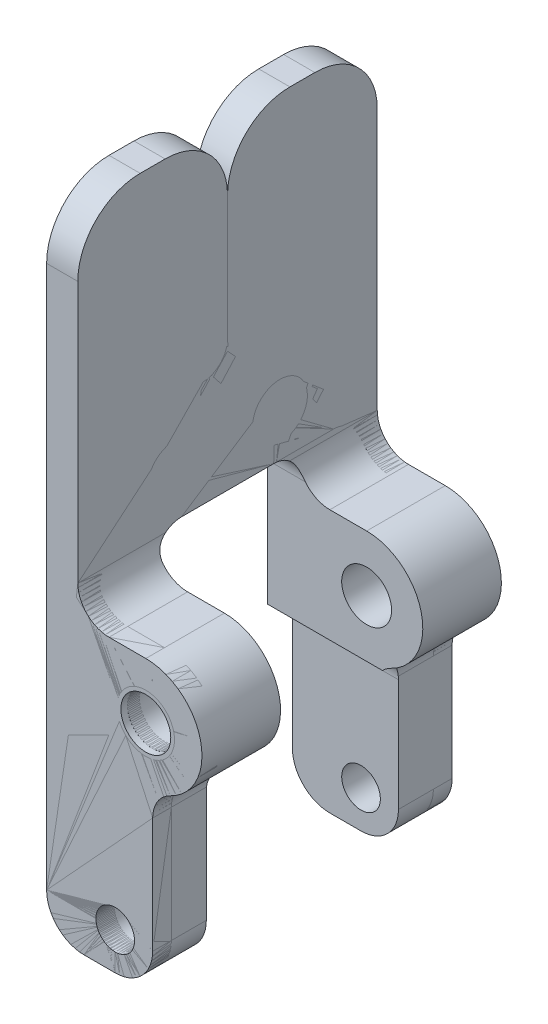
from build123d import *

# Parameters (mm, degrees)
CROQUIS1_R              = 2
CROQUIS1_R_2            = 1.55
SALIENTE_EXTRUIR1_DEPTH = 24
CORTAR_EXTRUIR1_DEPTH   = 20
REDONDEO1_R             = 8
REDONDEO2_R             = 2
REDONDEO5_R             = 2.5
CROQUIS3_R              = 2.2
CORTAR_EXTRUIR2_DEPTH   = 20
CROQUIS4_W              = 1.5
CROQUIS4_H              = 7.2
CORTAR_EXTRUIR3_DEPTH   = 20
SALIENTE_EXTRUIR2_REACH = 43.512
REDONDEO7_R             = 2
CROQUIS6_W              = 7.2
CROQUIS6_H              = 3
CORTAR_EXTRUIR4_DEPTH   = 1.5
REDONDEO8_R             = 3
REDONDEO9_R             = 5
CHAFL_N1_SIZE           = 0.3
CHAFL_N1_SIZE2          = 0.519615242


with BuildPart() as part:
    # Croquis1 → Saliente-Extruir1 (new body)
    with BuildSketch(Plane.XY):
        with BuildLine():
            Line((-5.5, 0), (-5.5, 31.5))
            Line((-5.5, 31.5), (-3, 31.5))
            Line((-3, 31.5), (-3, 20.05))
            Line((-3, 20.05), (2.45, 20.05))
            ThreePointArc((2.45, 20.05), (6.941557686, 15.825516889), (3, 11.08373758))
            Line((3, 11.08373758), (3, 0))
            ThreePointArc((3, 0), (2.121320344, -2.121320344), (0, -3))
            Line((0, -3), (-2.5, -3))
            ThreePointArc((-2.5, -3), (-4.621320344, -2.121320344), (-5.5, 0))
        make_face()
        with Locations((2.45, 15.55)):
            Circle(CROQUIS1_R, mode=Mode.SUBTRACT)
        Circle(CROQUIS1_R_2, mode=Mode.SUBTRACT)
    extrude(amount=SALIENTE_EXTRUIR1_DEPTH)

    # Croquis2 → Cortar-Extruir1 (cut)
    with BuildSketch(Plane.ZY.offset(5.5)):
        Polygon((1.5, -3), (19.7, -3), (19.7, 11), (17.7, 11), (17.7, 23), (1.5, 23), align=None)
    extrude(amount=-CORTAR_EXTRUIR1_DEPTH, mode=Mode.SUBTRACT)

    # Redondeo1
    redondeo1_edges = [part.edges().sort_by_distance(p)[0] for p in [
        (-4.25, 31.5, 0),
        (-4.25, 31.5, 24),
    ]]
    fillet(redondeo1_edges, radius=REDONDEO1_R)

    # Redondeo2
    redondeo2_edges = [part.edges().sort_by_distance(p)[0] for p in [
        (-1.25, 11, 19.7),
        (-4.25, 23, 17.7),
        (-4.25, 23, 1.5),
    ]]
    fillet(redondeo2_edges, radius=REDONDEO2_R - 0.0001)  # a hair under: the kernel refuses the full size

    # Redondeo5
    redondeo5_edges = [part.edges().sort_by_distance(p)[0] for p in [
        (3, 11.08373758, 0.75),
        (-3, 20.05, 20.85),
        (3, 11.08373758, 20.85),
        (-3, 20.05, 0.75),
    ]]
    fillet(redondeo5_edges, radius=REDONDEO5_R)

    # Croquis3 → Cortar-Extruir2 (cut)
    with BuildSketch(Plane.ZY.offset(5.5)):
        with Locations((7.8, 26.4)):
            Circle(CROQUIS3_R)
    extrude(amount=-CORTAR_EXTRUIR2_DEPTH, mode=Mode.SUBTRACT)

    # Croquis4 → Cortar-Extruir3 (cut)
    with BuildSketch(Plane.XZ.offset(-23)):
        with Locations((-4.75, 7.8)):
            Rectangle(CROQUIS4_W, CROQUIS4_H)
    extrude(amount=-CORTAR_EXTRUIR3_DEPTH, mode=Mode.SUBTRACT)

    # Saliente-Extruir2: up to this face of the body (flat: up to its plane)
    saliente_extruir2_end = Plane(part.part.faces().sort_by_distance((-3, 26.79790631, 12.475730365))[0])
    # Croquis5 → Saliente-Extruir2 (add, up to the picked face)
    with BuildSketch(Plane.ZY.offset(5.5), mode=Mode.PRIVATE) as saliente_extruir2_sk1:
        Polygon((0, 23.5), (0, 48.5), (12, 48.5), (12, 30), (4.2, 30), align=None)
    saliente_extruir2_tool1 = split(extrude(saliente_extruir2_sk1.sketch, amount=-SALIENTE_EXTRUIR2_REACH, mode=Mode.PRIVATE), bisect_by=saliente_extruir2_end, keep=Keep.BOTH, mode=Mode.PRIVATE)
    add(saliente_extruir2_tool1.solids().sort_by(Axis((-5.5, 38.588691, 5.733546), (1, 0, 0)))[0])

    # Redondeo7
    redondeo7_edges = [part.edges().sort_by_distance(p)[0] for p in [
        (-4.25, 31.5, 12),
    ]]
    fillet(redondeo7_edges, radius=REDONDEO7_R)

    # Croquis6 → Cortar-Extruir4 (cut)
    with BuildSketch(Plane.ZY.offset(5.5)):
        with Locations((7.8, 30)):
            Rectangle(CROQUIS6_W, CROQUIS6_H)
    extrude(amount=-CORTAR_EXTRUIR4_DEPTH, mode=Mode.SUBTRACT)

    # Redondeo8
    redondeo8_edges = [part.edges().sort_by_distance(p)[0] for p in [
        (-4.75, 31.5, 4.2),
        (-4.75, 31.5, 11.4),
    ]]
    fillet(redondeo8_edges, radius=REDONDEO8_R)

    # Redondeo9
    redondeo9_edges = [part.edges().sort_by_distance(p)[0] for p in [
        (-4.25, 48.5, 12),
        (-4.25, 48.5, 0),
    ]]
    fillet(redondeo9_edges, radius=REDONDEO9_R)

    # Chaflán1
    chafl_n1_edges = [part.edges().sort_by_distance(p)[0] for p in [
        (0.45, 15.55, 24),
    ]]
    chafl_n1_side = [part.faces().sort_by_distance(p)[0] for p in [
        (-0.877926413, 10.141568141, 24),
    ]]
    chamfer(chafl_n1_edges, length=CHAFL_N1_SIZE, length2=CHAFL_N1_SIZE2, reference=chafl_n1_side[0])


with BuildPart() as body_2:
    # Simetría1: mirrored copy
    add(part.part.mirror(Plane.XY.offset(12)))


solid = Compound([part.part, body_2.part])
